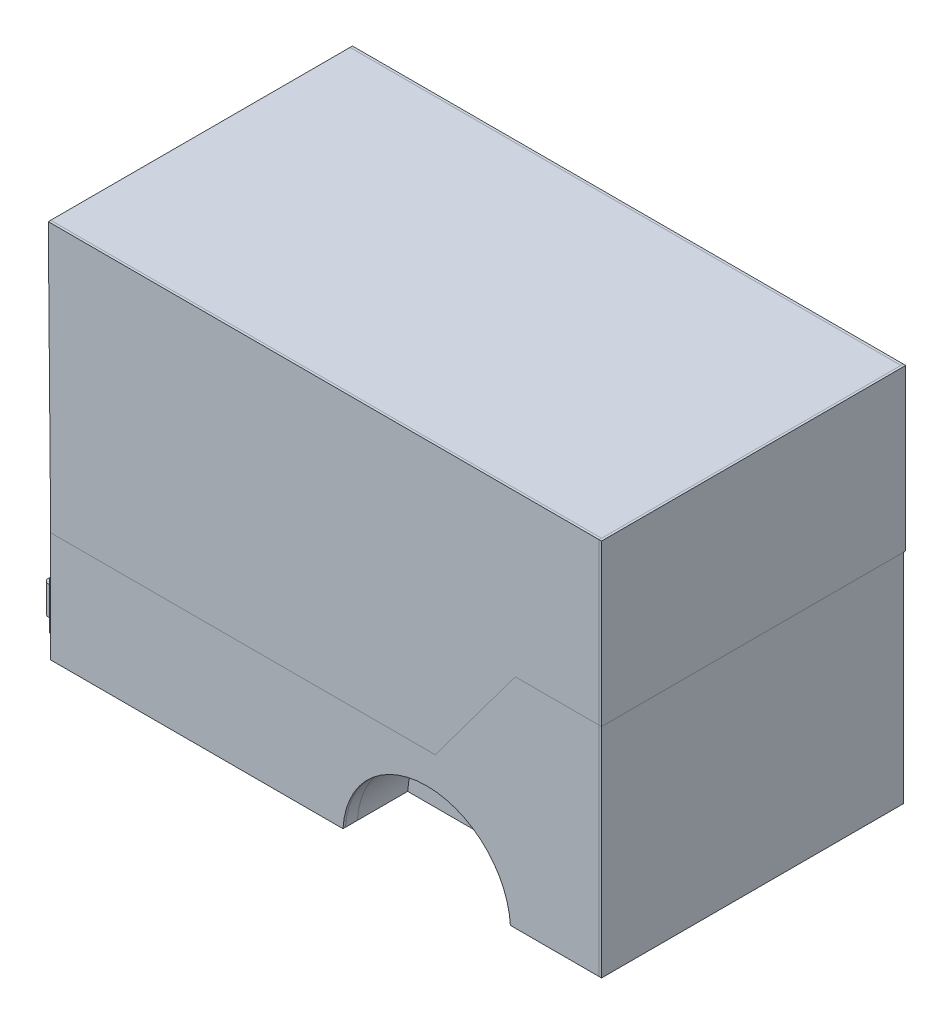
from build123d import *

# Parameters (mm, degrees)
SKETCH_1_W                = 229
SKETCH_1_H                = 125
EXTRUDE_1_DEPTH           = 88
SKETCH_4_W                = 125
SKETCH_4_H                = 88
SKETCH_4_W_2              = 123
SKETCH_4_H_2              = 86
CUT_EXTRUDE_3_DEPTH       = 1
SKETCH_5_W                = 125
SKETCH_5_H                = 88
EXTRUDE_2_DEPTH           = 1
SKETCH_11_W               = 5
SKETCH_11_H               = 20
EXTRUDE_3_DEPTH           = 2
SKETCH_12_R               = 2
EXTRUDE_4_DEPTH           = 12
SKETCH_13_R               = 35
CUT_EXTRUDE_7_DEPTH       = 26
CUT_EXTRUDE_START         = -26
SKETCH_14_R               = 35
CUT_EXTRUDE_8_DEPTH       = 26
SKETCH_16_W               = 229
SKETCH_16_H               = 125
EXTRUDE_6_DEPTH           = 70
SHELL_START               = -980.231317195
SHELL_1_OUTLINE_W         = 148
SHELL_1_OUTLINE_H         = 115
SHELL_1_DEPTH             = 113.617262665
SHELL_START_2             = -787.84857986
SHELL_1_2_OUTLINE_W       = 148
SHELL_1_2_OUTLINE_H       = 115
SHELL_1_2_DEPTH           = 31.617262665
SHELL_1_3_OUTLINE_W       = 3
SHELL_1_3_OUTLINE_H       = 63
SHELL_1_3_DEPTH           = 224
SHELL_START_3             = -981.231317195
SHELL_1_4_DEPTH           = 1
SHELL_START_4             = 7.020467364
SHELL_1_5_DEPTH           = 115
SHELL_START_5             = 33.020467364
SHELL_1_6_DEPTH           = 63
CUT_EXTRUDE_START_2       = -70
CUT_EXTRUDE_9_DEPTH       = 70
SKETCH_20_W               = 125
SKETCH_20_H               = 158
SKETCH_20_W_2             = 115
SKETCH_20_H_2             = 148
EXTRUDE_7_DEPTH           = 1
CUT_EXTRUDE_START_3       = -5
CUT_EXTRUDE_14_DEPTH      = 5
EXTRUDE_8_DEPTH           = 5
SKETCH_26_W               = 230
SKETCH_26_H               = 125
CUT_EXTRUDE_15_DEPTH      = 5
SKETCH_27_W               = 230
SKETCH_27_H               = 125
EXTRUDE_9_DEPTH           = 5
SKETCH_28_W               = 5
SKETCH_28_H               = 115
EXTRUDE_10_DEPTH          = 148
EXTRUDE_11_DEPTH          = 1
EXTRUDE_12_DEPTH          = 1
SKETCH_32_W               = 127
SKETCH_32_H               = 67.090624259
EXTRUDE_13_DEPTH          = 1
SKETCH_33_W               = 126
SKETCH_33_H               = 90.909375741
EXTRUDE_14_DEPTH          = 1
CUT_EXTRUDE_16_DEPTH      = 40
CUT_EXTRUDE_16_DEPTH_BACK = 10
SKETCH_34_W               = 225
SKETCH_34_H               = 5
SKETCH_35_W               = 220
SKETCH_35_H               = 153
EXTRUDE_16_DEPTH          = 5
SKETCH_36_W               = 5
SKETCH_36_H               = 153
EXTRUDE_17_DEPTH          = 5
CUT_EXTRUDE_17_DEPTH      = 5
SKETCH_39_W               = 115
SKETCH_39_H               = 5
CUT_EXTRUDE_18_DEPTH      = 5
SKETCH_40_W               = 5
SKETCH_40_H               = 120
EXTRUDE_19_DEPTH          = 153
SKETCH_45_W               = 78.76547467
SKETCH_45_H               = 26
EXTRUDE_21_DEPTH          = 33
CUT_EXTRUDE_20_DEPTH      = 21
SKETCH_48_R               = 34.912032086
CUT_EXTRUDE_21_DEPTH      = 21
SKETCH_49_W               = 26.617262665
SKETCH_49_H               = 26
EXTRUDE_22_DEPTH          = 33
EXTRUDE_22_2_DEPTH        = 33
SKETCH_49_W_2             = 27.3125
EXTRUDE_22_3_DEPTH        = 33
EXTRUDE_22_4_DEPTH        = 33
EXTRUDE_22_5_DEPTH        = 33
EXTRUDE_22_6_DEPTH        = 33
EXTRUDE_22_7_DEPTH        = 33
EXTRUDE_22_8_DEPTH        = 33
EXTRUDE_22_9_DEPTH        = 33
EXTRUDE_22_10_DEPTH       = 33
EXTRUDE_22_11_DEPTH       = 33
EXTRUDE_22_12_DEPTH       = 33
SKETCH_49_W_3             = 23.446369054
EXTRUDE_22_13_DEPTH       = 33
SKETCH_49_W_4             = 23.446369055
EXTRUDE_22_14_DEPTH       = 33
EXTRUDE_22_15_DEPTH       = 33
EXTRUDE_22_16_DEPTH       = 33
EXTRUDE_22_17_DEPTH       = 33
EXTRUDE_22_18_DEPTH       = 33
EXTRUDE_22_19_DEPTH       = 33
EXTRUDE_22_20_DEPTH       = 33
EXTRUDE_22_21_DEPTH       = 33
EXTRUDE_22_22_DEPTH       = 33
EXTRUDE_22_23_DEPTH       = 33
EXTRUDE_22_24_DEPTH       = 33
EXTRUDE_22_25_DEPTH       = 33
EXTRUDE_22_26_DEPTH       = 33
PATTERN_LINEAR_1_COUNT    = 4
PATTERN_LINEAR_1_PITCH    = 35
PATTERN_LINEAR_1_2_COUNT  = 4
PATTERN_LINEAR_1_2_PITCH  = 35
PATTERN_LINEAR_1_3_COUNT  = 4
PATTERN_LINEAR_1_3_PITCH  = 35
PATTERN_LINEAR_1_4_COUNT  = 4
PATTERN_LINEAR_1_4_PITCH  = 35
PATTERN_LINEAR_1_5_COUNT  = 4
PATTERN_LINEAR_1_5_PITCH  = 35
PATTERN_LINEAR_1_6_COUNT  = 4
PATTERN_LINEAR_1_6_PITCH  = 35
PATTERN_LINEAR_1_7_COUNT  = 4
PATTERN_LINEAR_1_7_PITCH  = 35
PATTERN_LINEAR_1_8_COUNT  = 4
PATTERN_LINEAR_1_8_PITCH  = 35
PATTERN_LINEAR_1_9_COUNT  = 4
PATTERN_LINEAR_1_9_PITCH  = 35
PATTERN_LINEAR_1_10_COUNT = 4
PATTERN_LINEAR_1_10_PITCH = 35
PATTERN_LINEAR_1_11_COUNT = 4
PATTERN_LINEAR_1_11_PITCH = 35
PATTERN_LINEAR_1_12_COUNT = 4
PATTERN_LINEAR_1_12_PITCH = 35
PATTERN_LINEAR_1_13_COUNT = 4
PATTERN_LINEAR_1_13_PITCH = 35
PATTERN_LINEAR_1_14_COUNT = 4
PATTERN_LINEAR_1_14_PITCH = 35
PATTERN_LINEAR_1_15_COUNT = 4
PATTERN_LINEAR_1_15_PITCH = 35
PATTERN_LINEAR_1_16_COUNT = 4
PATTERN_LINEAR_1_16_PITCH = 35
PATTERN_LINEAR_1_17_COUNT = 4
PATTERN_LINEAR_1_17_PITCH = 35
PATTERN_LINEAR_1_18_COUNT = 4
PATTERN_LINEAR_1_18_PITCH = 35
PATTERN_LINEAR_1_19_COUNT = 4
PATTERN_LINEAR_1_19_PITCH = 35
PATTERN_LINEAR_1_20_COUNT = 4
PATTERN_LINEAR_1_20_PITCH = 35
PATTERN_LINEAR_1_21_COUNT = 4
PATTERN_LINEAR_1_21_PITCH = 35
PATTERN_LINEAR_1_22_COUNT = 4
PATTERN_LINEAR_1_22_PITCH = 35
PATTERN_LINEAR_1_23_COUNT = 4
PATTERN_LINEAR_1_23_PITCH = 35
PATTERN_LINEAR_1_24_COUNT = 4
PATTERN_LINEAR_1_24_PITCH = 35
PATTERN_LINEAR_1_25_COUNT = 4
PATTERN_LINEAR_1_25_PITCH = 35
PATTERN_LINEAR_1_26_COUNT = 4
PATTERN_LINEAR_1_26_PITCH = 35
SKETCH_54_W               = 38.882737335
SKETCH_54_H               = 25
EXTRUDE_23_DEPTH          = 34
EXTRUDE_23_2_DEPTH        = 34
PATTERN_LINEAR_2_COUNT    = 3
PATTERN_LINEAR_2_PITCH    = 35
DELETE_START              = 110
DELETE_BODY_6_OUTLINE_W   = 23.446369054
DELETE_BODY_6_OUTLINE_H   = 26
DELETE_BODY_6_DEPTH       = 33
DELETE_BODY_7_OUTLINE_W   = 23.446369055
DELETE_BODY_7_OUTLINE_H   = 26
DELETE_BODY_7_DEPTH       = 33
DELETE_START_2            = 96.020467364
DELETE_BODY_8_OUTLINE_W   = 26.617262665
DELETE_BODY_8_OUTLINE_H   = 33
DELETE_BODY_8_DEPTH       = 26
DELETE_BODY_9_OUTLINE_W   = 26.617262665
DELETE_BODY_9_OUTLINE_H   = 33
DELETE_BODY_9_DEPTH       = 26
DELETE_BODY_10_OUTLINE_W  = 23.446369054
DELETE_BODY_10_OUTLINE_H  = 26
DELETE_BODY_10_DEPTH      = 33
DELETE_START_3            = 75
DELETE_BODY_11_OUTLINE_W  = 23.446369054
DELETE_BODY_11_OUTLINE_H  = 26
DELETE_BODY_11_DEPTH      = 33
DELETE_BODY_12_OUTLINE_W  = 23.446369055
DELETE_BODY_12_OUTLINE_H  = 26
DELETE_BODY_12_DEPTH      = 33


with BuildPart() as part:
    # 스케치1 → 보스-돌출1 (new body)
    with BuildSketch(Plane(origin=(0, 0, 0), x_dir=(1, 0, 0), z_dir=(0, 1, 0))):
        with Locations((-871.731317195, -64.520467364)):
            Rectangle(SKETCH_1_W, SKETCH_1_H)
    extrude(amount=EXTRUDE_1_DEPTH)

    # 스케치4 → 컷-돌출3 (cut)
    # profile 1 of 2: a face of its own
    with BuildSketch(Plane.ZY.offset(986.231317195)):
        with Locations((64.520467364, 44)):
            Rectangle(SKETCH_4_W, SKETCH_4_H)
        with Locations((64.520467364, 44)):
            Rectangle(SKETCH_4_W_2, SKETCH_4_H_2, mode=Mode.SUBTRACT)
    # profile 2 of 2: a face of its own
    with BuildSketch(Plane.ZY.offset(986.231317195)):
        with BuildLine():
            Line((6.020467364, 84), (6.020467364, 67.306026885))
            ThreePointArc((6.020467364, 67.306026885), (6.552613646, 56.95178287), (8.143444971, 46.70664722))
            Line((8.143444971, 46.70664722), (8.939528918, 42.885444272))
            ThreePointArc((8.939528918, 42.885444272), (10.498858633, 32.843182595), (11.020467364, 22.693973115))
            Line((11.020467364, 22.693973115), (11.020467364, 2))
            Line((11.020467364, 2), (118.020467364, 2))
            Line((118.020467364, 2), (118.020467364, 22.693973115))
            ThreePointArc((118.020467364, 22.693973115), (118.542076095, 32.843182595), (120.10140581, 42.885444272))
            Line((120.10140581, 42.885444272), (120.897489758, 46.70664722))
            ThreePointArc((120.897489758, 46.70664722), (122.488321083, 56.95178287), (123.020467364, 67.306026885))
            Line((123.020467364, 67.306026885), (123.020467364, 84))
            Line((123.020467364, 84), (6.020467364, 84))
        make_face()
        with BuildLine():
            Line((12.020467364, 22.693973115), (12.020467364, 3))
            Line((12.020467364, 3), (117.020467364, 3))
            Line((117.020467364, 3), (117.020467364, 22.693973115))
            ThreePointArc((117.020467364, 22.693973115), (117.547344871, 32.945699863), (119.122425391, 43.089398526))
            Line((119.122425391, 43.089398526), (119.918509338, 46.910601474))
            ThreePointArc((119.918509338, 46.910601474), (121.493589858, 57.054300137), (122.020467364, 67.306026885))
            Line((122.020467364, 67.306026885), (122.020467364, 83))
            Line((122.020467364, 83), (7.020467364, 83))
            Line((7.020467364, 83), (7.020467364, 67.306026885))
            ThreePointArc((7.020467364, 67.306026885), (7.547344871, 57.054300137), (9.122425391, 46.910601474))
            Line((9.122425391, 46.910601474), (9.918509338, 43.089398526))
            ThreePointArc((9.918509338, 43.089398526), (11.493589858, 32.945699863), (12.020467364, 22.693973115))
        make_face(mode=Mode.SUBTRACT)
    extrude(amount=-CUT_EXTRUDE_3_DEPTH, mode=Mode.SUBTRACT)

    # 스케치5 → 보스-돌출2 (add)
    with BuildSketch(Plane(origin=(-757.231317195, 0, 0), x_dir=(0, 0, -1), z_dir=(1, 0, 0))):
        with Locations((-64.520467364, 44)):
            Rectangle(SKETCH_5_W, SKETCH_5_H)
    extrude(amount=EXTRUDE_2_DEPTH)

    # 스케치13 → 컷-돌출7 (cut)
    with BuildSketch(Plane.XY.offset(127.020467364)):
        with Locations((-827.231317195, -2)):
            Circle(SKETCH_13_R)
    extrude(amount=-CUT_EXTRUDE_7_DEPTH, mode=Mode.SUBTRACT)

    # 스케치14 → 컷-돌출8 (cut)
    with BuildSketch(Plane(origin=(0, 0, 2.020467364), x_dir=(-1, 0, 0), z_dir=(0, 0, -1)).offset(CUT_EXTRUDE_START)):
        with Locations((827.231317195, -2)):
            Circle(SKETCH_14_R)
    extrude(amount=CUT_EXTRUDE_8_DEPTH, mode=Mode.SUBTRACT)

    # 스케치16 → 보스-돌출6 (add)
    with BuildSketch(Plane(origin=(0, 88, 0), x_dir=(1, 0, 0), z_dir=(0, 1, 0))):
        with Locations((-870.731317195, -64.520467364)):
            Rectangle(SKETCH_16_W, SKETCH_16_H)
    extrude(amount=EXTRUDE_6_DEPTH)

    # 쉘1: read off the stored shape, not the designer's step
    # 쉘1 outline → 쉘1 (cut)
    with BuildSketch(Plane.YZ.offset(SHELL_START)):
        with Locations((79, 64.520467364)):
            Rectangle(SHELL_1_OUTLINE_W, SHELL_1_OUTLINE_H)
    extrude(amount=SHELL_1_DEPTH, mode=Mode.SUBTRACT)

    # Shell 1 2 outline → Shell 1 2 (cut)
    with BuildSketch(Plane.YZ.offset(SHELL_START_2)):
        with Locations((79, 64.520467364)):
            Rectangle(SHELL_1_2_OUTLINE_W, SHELL_1_2_OUTLINE_H)
    extrude(amount=SHELL_1_2_DEPTH, mode=Mode.SUBTRACT)

    # Shell 1 3 outline → Shell 1 3 (cut)
    with BuildSketch(Plane.YZ.offset(SHELL_START)):
        with Locations((6.5, 64.520467364)):
            Rectangle(SHELL_1_3_OUTLINE_W, SHELL_1_3_OUTLINE_H)
    extrude(amount=SHELL_1_3_DEPTH, mode=Mode.SUBTRACT)

    # Shell 1 4 outline → Shell 1 4 (cut)
    with BuildSketch(Plane.YZ.offset(SHELL_START_3)):
        with BuildLine():
            Line((8, 96.020467364), (8, 33.020467364))
            Line((8, 33.020467364), (8, 17.020467364))
            Line((8, 17.020467364), (22.693973115, 17.020467364))
            ThreePointArc((22.693973115, 17.020467364), (33.4582862, 16.467245983), (44.109169797, 14.813411437))
            Line((44.109169797, 14.813411437), (47.930372745, 14.017327489))
            ThreePointArc((47.930372745, 14.017327489), (57.566886475, 12.521000995), (67.306026885, 12.020467364))
            Line((67.306026885, 12.020467364), (78, 12.020467364))
            Line((78, 12.020467364), (78, 117.020467364))
            Line((78, 117.020467364), (67.306026885, 117.020467364))
            ThreePointArc((67.306026885, 117.020467364), (57.566886475, 116.519933734), (47.930372745, 115.023607239))
            Line((47.930372745, 115.023607239), (44.109169797, 114.227523292))
            ThreePointArc((44.109169797, 114.227523292), (33.4582862, 112.573688746), (22.693973115, 112.020467364))
            Line((22.693973115, 112.020467364), (8, 112.020467364))
            Line((8, 112.020467364), (8, 96.020467364))
        make_face()
    extrude(amount=SHELL_1_4_DEPTH, mode=Mode.SUBTRACT)

    # Shell 1 5 outline → Shell 1 5 (cut)
    with BuildSketch(Plane.XY.offset(SHELL_START_4)):
        with BuildLine():
            Line((-787.84857986, 5), (-787.84857986, 153))
            Line((-787.84857986, 153), (-866.61405453, 153))
            Line((-866.61405453, 153), (-866.61405453, 5))
            ThreePointArc((-866.61405453, 5), (-827.231317195, 38), (-787.84857986, 5))
        make_face()
    extrude(amount=SHELL_1_5_DEPTH, mode=Mode.SUBTRACT)

    # Shell 1 6 outline → Shell 1 6 (cut)
    with BuildSketch(Plane.XY.offset(SHELL_START_5)):
        with BuildLine():
            Line((-865.961150657, 8), (-788.501483733, 8))
            ThreePointArc((-788.501483733, 8), (-827.231317195, 38), (-865.961150657, 8))
        make_face()
    extrude(amount=SHELL_1_6_DEPTH, mode=Mode.SUBTRACT)

    # 스케치18 → 컷-돌출9 (cut)
    with BuildSketch(Plane(origin=(-981.231317195, 0, 0), x_dir=(0, 0, -1), z_dir=(1, 0, 0)).offset(CUT_EXTRUDE_START_2)):
        with BuildLine():
            Line((-17.020467364, 8), (-17.020467364, 22.693973115))
            ThreePointArc((-17.020467364, 22.693973115), (-16.467245983, 33.4582862), (-14.813411437, 44.109169797))
            Line((-14.813411437, 44.109169797), (-14.017327489, 47.930372745))
            ThreePointArc((-14.017327489, 47.930372745), (-12.521000995, 57.566886475), (-12.020467364, 67.306026885))
            Line((-12.020467364, 67.306026885), (-12.020467364, 78))
            Line((-12.020467364, 78), (-117.020467364, 78))
            Line((-117.020467364, 78), (-117.020467364, 67.306026885))
            ThreePointArc((-117.020467364, 67.306026885), (-116.519933734, 57.566886475), (-115.023607239, 47.930372745))
            Line((-115.023607239, 47.930372745), (-114.227523292, 44.109169797))
            ThreePointArc((-114.227523292, 44.109169797), (-112.573688746, 33.4582862), (-112.020467364, 22.693973115))
            Line((-112.020467364, 22.693973115), (-112.020467364, 8))
            Line((-112.020467364, 8), (-17.020467364, 8))
        make_face()
    extrude(amount=CUT_EXTRUDE_9_DEPTH, mode=Mode.SUBTRACT)

    # 스케치20 → 보스-돌출7 (add)
    with BuildSketch(Plane(origin=(-756.231317195, 0, 0), x_dir=(0, 0, -1), z_dir=(1, 0, 0))):
        with Locations((-64.520467364, 79)):
            Rectangle(SKETCH_20_W, SKETCH_20_H)
        with Locations((-64.520467364, 79)):
            Rectangle(SKETCH_20_W_2, SKETCH_20_H_2, mode=Mode.SUBTRACT)
    extrude(amount=EXTRUDE_7_DEPTH)

    # 스케치24 → 컷-돌출14 (cut)
    with BuildSketch(Plane.XY.offset(127.020467364).offset(CUT_EXTRUDE_START_3)):
        with BuildLine():
            Line((-755.231317195, 153), (-980.231317195, 153))
            Line((-980.231317195, 153), (-980.231317195, 5))
            Line((-980.231317195, 5), (-866.61405453, 5))
            ThreePointArc((-866.61405453, 5), (-827.231317195, 38), (-787.84857986, 5))
            Line((-787.84857986, 5), (-755.231317195, 5))
            Line((-755.231317195, 5), (-755.231317195, 153))
        make_face()
    extrude(amount=CUT_EXTRUDE_14_DEPTH, mode=Mode.SUBTRACT)

    # 스케치26 → 컷-돌출15 (cut)
    with BuildSketch(Plane(origin=(0, 158, 0), x_dir=(1, 0, 0), z_dir=(0, 1, 0))):
        with Locations((-870.231317195, -64.520467364)):
            Rectangle(SKETCH_26_W, SKETCH_26_H)
    extrude(amount=-CUT_EXTRUDE_15_DEPTH, mode=Mode.SUBTRACT)

    # 스케치34 → 컷-돌출16 (cut, two sides: drawn at the far end of the back side and taken through both)
    with BuildSketch(Plane(origin=(0, 5, 0), x_dir=(1, 0, 0), z_dir=(0, 1, 0)).offset(-CUT_EXTRUDE_16_DEPTH_BACK)):
        with Locations((-867.731317195, -124.520467364)):
            Rectangle(SKETCH_34_W, SKETCH_34_H)
    extrude(amount=CUT_EXTRUDE_16_DEPTH + CUT_EXTRUDE_16_DEPTH_BACK, mode=Mode.SUBTRACT)

    # 스케치39 → 컷-돌출18 (cut)
    with BuildSketch(Plane(origin=(-755.231317195, 0, 0), x_dir=(0, 0, -1), z_dir=(1, 0, 0))):
        with Locations((-64.520467364, 2.5)):
            Rectangle(SKETCH_39_W, SKETCH_39_H)
    extrude(amount=-CUT_EXTRUDE_18_DEPTH, mode=Mode.SUBTRACT)

    # 스케치45 → 보스-돌출21 (add)
    with BuildSketch(Plane(origin=(0, 5, 0), x_dir=(1, 0, 0), z_dir=(0, 1, 0))):
        with Locations((-827.231317195, -20.020467364)):
            Rectangle(SKETCH_45_W, SKETCH_45_H)
        with Locations((-827.231317195, -109.020467364)):
            Rectangle(SKETCH_45_W, SKETCH_45_H)
    extrude(amount=EXTRUDE_21_DEPTH)

    # 스케치47 → 컷-돌출20 (cut)
    with BuildSketch(Plane.XY.offset(122.020467364)):
        with BuildLine():
            Line((-862.174127614, 0), (-792.288506775, 0))
            ThreePointArc((-792.288506775, 0), (-827.231317195, 33), (-862.174127614, 0))
        make_face()
    extrude(amount=-CUT_EXTRUDE_20_DEPTH, mode=Mode.SUBTRACT)

    # 스케치48 → 컷-돌출21 (cut)
    with BuildSketch(Plane(origin=(0, 0, 7.020467364), x_dir=(-1, 0, 0), z_dir=(0, 0, -1))):
        with Locations((827.252311569, -1.914574066)):
            Circle(SKETCH_48_R)
    extrude(amount=-CUT_EXTRUDE_21_DEPTH, mode=Mode.SUBTRACT)


with BuildPart() as body_2:
    # 스케치11 → 보스-돌출3 (new body)
    with BuildSketch(Plane.ZY.offset(986.231317195)):
        with Locations((122.020467364, 16)):
            Rectangle(SKETCH_11_W, SKETCH_11_H)
    extrude(amount=EXTRUDE_3_DEPTH)

    # 스케치12 → 보스-돌출4 (add)
    with BuildSketch(Plane(origin=(0, 23, 0), x_dir=(1, 0, 0), z_dir=(0, 1, 0))):
        with Locations((-989.231317195, -122.020467364)):
            Circle(SKETCH_12_R)
    extrude(amount=-EXTRUDE_4_DEPTH)


with BuildPart() as body_3:
    # 대칭 복사1: mirrored copy
    add(body_2.part.mirror(Plane.XY.offset(64.520467364)))


with BuildPart() as body_4:
    # 스케치25 → 보스-돌출8 (new body)
    with BuildSketch(Plane.XY.offset(127.020467364)):
        with BuildLine():
            Line((-980.231317195, 153), (-755.231317195, 153))
            Line((-755.231317195, 153), (-755.231317195, 5))
            Line((-755.231317195, 5), (-787.616277727, 5))
            ThreePointArc((-787.616277727, 5), (-826.999015062, 38), (-866.381752397, 5))
            Line((-866.381752397, 5), (-980.231317195, 5))
            Line((-980.231317195, 5), (-980.231317195, 153))
        make_face()
    extrude(amount=-EXTRUDE_8_DEPTH)


with BuildPart() as body_5:
    # 스케치27 → 보스-돌출9 (new body)
    with BuildSketch(Plane(origin=(0, 153, 0), x_dir=(1, 0, 0), z_dir=(0, 1, 0))):
        with Locations((-870.231317195, -64.520467364)):
            Rectangle(SKETCH_27_W, SKETCH_27_H)
    extrude(amount=EXTRUDE_9_DEPTH)


with BuildPart() as body_6:
    # 스케치28 → 보스-돌출10 (new body)
    with BuildSketch(Plane(origin=(0, 5, 0), x_dir=(1, 0, 0), z_dir=(0, 1, 0))):
        with Locations((-757.731317195, -64.520467364)):
            Rectangle(SKETCH_28_W, SKETCH_28_H)
    extrude(amount=EXTRUDE_10_DEPTH)


with BuildPart() as body_7:
    # 스케치29 → 보스-돌출11 (new body)
    with BuildSketch(Plane(origin=(0, 0, 2.020467364), x_dir=(-1, 0, 0), z_dir=(0, 0, -1))):
        with BuildLine():
            Line((984.231317195, 0), (984.231317195, 46))
            Line((984.231317195, 46), (823.655113572, 46))
            Line((823.655113572, 46), (790.231317195, 90.909375741))
            Line((790.231317195, 90.909375741), (755.231317195, 90.909375741))
            Line((755.231317195, 90.909375741), (755.231317195, 0))
            Line((755.231317195, 0), (792.288506775, 0))
            ThreePointArc((792.288506775, 0), (827.231317195, 33), (862.174127614, 0))
            Line((862.174127614, 0), (984.231317195, 0))
        make_face()
    extrude(amount=EXTRUDE_11_DEPTH)


with BuildPart() as body_8:
    # 스케치30 → 보스-돌출12 (new body)
    with BuildSketch(Plane(origin=(0, 0, 2.020467364), x_dir=(-1, 0, 0), z_dir=(0, 0, -1))):
        Polygon((755.231317195, 90.909375741), (755.231317195, 158), (985.231317195, 158), (984.231317195, 46), (823.655113572, 46), (790.231317195, 90.909375741), align=None)
    extrude(amount=EXTRUDE_12_DEPTH)


with BuildPart() as body_8_2:
    # 대칭 복사3: mirrored copy
    add(body_8.part.mirror(Plane.XY.offset(64.520467364)))


with BuildPart() as body_9:
    # Mirror 3 2: mirrored copy
    add(body_7.part.mirror(Plane.XY.offset(64.520467364)))


with BuildPart() as body_10:
    # 스케치32 → 보스-돌출13 (new body)
    with BuildSketch(Plane(origin=(-755.231317195, 0, 0), x_dir=(0, 0, -1), z_dir=(1, 0, 0))):
        with Locations((-64.520467364, 124.454687871)):
            Rectangle(SKETCH_32_W, SKETCH_32_H)
    extrude(amount=EXTRUDE_13_DEPTH)


with BuildPart() as body_11:
    # 스케치33 → 보스-돌출14 (new body)
    with BuildSketch(Plane(origin=(-755.231317195, 0, 0), x_dir=(0, 0, -1), z_dir=(1, 0, 0))):
        with Locations((-65.020467364, 45.454687871)):
            Rectangle(SKETCH_33_W, SKETCH_33_H)
    extrude(amount=EXTRUDE_14_DEPTH)


with BuildPart() as body_12:
    # 대칭 복사4: mirrored copy
    add(body_2.part.mirror(Plane.XY.offset(64.520467364)))


with BuildPart() as body_12_2:
    # 스케치35 → 보스-돌출16 (new body)
    with BuildSketch(Plane.XY.offset(122.020467364)):
        with Locations((-870.231317195, 76.5)):
            Rectangle(SKETCH_35_W, SKETCH_35_H)
    extrude(amount=EXTRUDE_16_DEPTH)

    # 스케치36 → 보스-돌출17 (add)
    with BuildSketch(Plane(origin=(-760.231317195, 0, 0), x_dir=(0, 0, -1), z_dir=(1, 0, 0))):
        with Locations((-124.520467364, 76.5)):
            Rectangle(SKETCH_36_W, SKETCH_36_H)
    extrude(amount=EXTRUDE_17_DEPTH)

    # 스케치37 → 컷-돌출17 (cut)
    with BuildSketch(Plane.XY.offset(127.020467364)):
        with BuildLine():
            Line((-862.174127614, 0), (-792.288506775, 0))
            ThreePointArc((-792.288506775, 0), (-827.231317195, 33), (-862.174127614, 0))
        make_face()
    extrude(amount=-CUT_EXTRUDE_17_DEPTH, mode=Mode.SUBTRACT)


with BuildPart() as body_12_3:
    # 스케치40 → 보스-돌출19 (new body)
    with BuildSketch(Plane.XZ):
        with Locations((-757.731317195, 67.020467364)):
            Rectangle(SKETCH_40_W, SKETCH_40_H)
    extrude(amount=-EXTRUDE_19_DEPTH)


with BuildPart() as body_13:
    # 스케치49 → 보스-돌출22 (new body)
    with BuildSketch(Plane(origin=(0, 5, 0), x_dir=(1, 0, 0), z_dir=(0, 1, 0))):
        with Locations((-773.539948528, -20.020467364)):
            Rectangle(SKETCH_49_W, SKETCH_49_H)
    extrude(amount=EXTRUDE_22_DEPTH)

    # 선형 패턴1: body 13 ×4


with BuildPart() as body_14:
    # 스케치49 → Extrude 22 2 (new body)
    with BuildSketch(Plane(origin=(0, 5, 0), x_dir=(1, 0, 0), z_dir=(0, 1, 0))):
        with Locations((-773.539948528, -109.020467364)):
            Rectangle(SKETCH_49_W, SKETCH_49_H)
    extrude(amount=EXTRUDE_22_2_DEPTH)

    # Pattern Linear 1 2: body 14 ×4


with BuildPart() as body_15:
    # 스케치49 → Extrude 22 3 (new body)
    with BuildSketch(Plane(origin=(0, 5, 0), x_dir=(1, 0, 0), z_dir=(0, 1, 0))):
        with Locations((-938.265067195, -109.020467364)):
            Rectangle(SKETCH_49_W_2, SKETCH_49_H)
    extrude(amount=EXTRUDE_22_3_DEPTH)

    # Pattern Linear 1 19: body 15 ×4


with BuildPart() as body_16:
    # 스케치49 → Extrude 22 4 (new body)
    with BuildSketch(Plane(origin=(0, 5, 0), x_dir=(1, 0, 0), z_dir=(0, 1, 0))):
        with Locations((-966.575067195, -109.020467364)):
            Rectangle(SKETCH_49_W_2, SKETCH_49_H)
    extrude(amount=EXTRUDE_22_4_DEPTH)

    # Pattern Linear 1 23: body 16 ×4


with BuildPart() as body_17:
    # 스케치49 → Extrude 22 5 (new body)
    with BuildSketch(Plane(origin=(0, 5, 0), x_dir=(1, 0, 0), z_dir=(0, 1, 0))):
        with Locations((-909.955067195, -109.020467364)):
            Rectangle(SKETCH_49_W_2, SKETCH_49_H)
    extrude(amount=EXTRUDE_22_5_DEPTH)

    # Pattern Linear 1 18: body 17 ×4


with BuildPart() as body_18:
    # 스케치49 → Extrude 22 6 (new body)
    with BuildSketch(Plane(origin=(0, 5, 0), x_dir=(1, 0, 0), z_dir=(0, 1, 0))):
        with Locations((-881.645067195, -109.020467364)):
            Rectangle(SKETCH_49_W_2, SKETCH_49_H)
    extrude(amount=EXTRUDE_22_6_DEPTH)

    # Pattern Linear 1 11: body 18 ×4


with BuildPart() as body_19:
    # 스케치49 → Extrude 22 7 (new body)
    with BuildSketch(Plane(origin=(0, 5, 0), x_dir=(1, 0, 0), z_dir=(0, 1, 0))):
        with Locations((-938.265067195, -80.020467364)):
            Rectangle(SKETCH_49_W_2, SKETCH_49_H)
    extrude(amount=EXTRUDE_22_7_DEPTH)

    # Pattern Linear 1 20: body 19 ×4


with BuildPart() as body_20:
    # 스케치49 → Extrude 22 8 (new body)
    with BuildSketch(Plane(origin=(0, 5, 0), x_dir=(1, 0, 0), z_dir=(0, 1, 0))):
        with Locations((-909.955067195, -80.020467364)):
            Rectangle(SKETCH_49_W_2, SKETCH_49_H)
    extrude(amount=EXTRUDE_22_8_DEPTH)

    # Pattern Linear 1 17: body 20 ×4


with BuildPart() as body_21:
    # 스케치49 → Extrude 22 9 (new body)
    with BuildSketch(Plane(origin=(0, 5, 0), x_dir=(1, 0, 0), z_dir=(0, 1, 0))):
        with Locations((-881.645067195, -80.020467364)):
            Rectangle(SKETCH_49_W_2, SKETCH_49_H)
    extrude(amount=EXTRUDE_22_9_DEPTH)

    # Pattern Linear 1 12: body 21 ×4


with BuildPart() as body_22:
    # 스케치49 → Extrude 22 10 (new body)
    with BuildSketch(Plane(origin=(0, 5, 0), x_dir=(1, 0, 0), z_dir=(0, 1, 0))):
        with Locations((-966.575067195, -80.020467364)):
            Rectangle(SKETCH_49_W_2, SKETCH_49_H)
    extrude(amount=EXTRUDE_22_10_DEPTH)

    # Pattern Linear 1 24: body 22 ×4


with BuildPart() as body_23:
    # 스케치49 → Extrude 22 11 (new body)
    with BuildSketch(Plane(origin=(0, 5, 0), x_dir=(1, 0, 0), z_dir=(0, 1, 0))):
        with Locations((-853.335067195, -80.020467364)):
            Rectangle(SKETCH_49_W_2, SKETCH_49_H)
    extrude(amount=EXTRUDE_22_11_DEPTH)

    # Pattern Linear 1 10: body 23 ×4


with BuildPart() as body_24:
    # 스케치49 → Extrude 22 12 (new body)
    with BuildSketch(Plane(origin=(0, 5, 0), x_dir=(1, 0, 0), z_dir=(0, 1, 0))):
        with Locations((-825.025067195, -80.020467364)):
            Rectangle(SKETCH_49_W_2, SKETCH_49_H)
    extrude(amount=EXTRUDE_22_12_DEPTH)

    # Pattern Linear 1 7: body 24 ×4


with BuildPart() as body_25:
    # 스케치49 → Extrude 22 13 (new body)
    with BuildSketch(Plane(origin=(0, 5, 0), x_dir=(1, 0, 0), z_dir=(0, 1, 0))):
        with Locations((-771.954501722, -80.020467364)):
            Rectangle(SKETCH_49_W_3, SKETCH_49_H)
    extrude(amount=EXTRUDE_22_13_DEPTH)

    # Pattern Linear 1 3: body 25 ×4


with BuildPart() as body_26:
    # 스케치49 → Extrude 22 14 (new body)
    with BuildSketch(Plane(origin=(0, 5, 0), x_dir=(1, 0, 0), z_dir=(0, 1, 0))):
        with Locations((-796.400870777, -80.020467364)):
            Rectangle(SKETCH_49_W_4, SKETCH_49_H)
    extrude(amount=EXTRUDE_22_14_DEPTH)

    # Pattern Linear 1 6: body 26 ×4


with BuildPart() as body_27:
    # 스케치49 → Extrude 22 15 (new body)
    with BuildSketch(Plane(origin=(0, 5, 0), x_dir=(1, 0, 0), z_dir=(0, 1, 0))):
        with Locations((-771.954501722, -49.020467364)):
            Rectangle(SKETCH_49_W_3, SKETCH_49_H)
    extrude(amount=EXTRUDE_22_15_DEPTH)

    # Pattern Linear 1 4: body 27 ×4


with BuildPart() as body_28:
    # 스케치49 → Extrude 22 16 (new body)
    with BuildSketch(Plane(origin=(0, 5, 0), x_dir=(1, 0, 0), z_dir=(0, 1, 0))):
        with Locations((-796.400870777, -49.020467364)):
            Rectangle(SKETCH_49_W_4, SKETCH_49_H)
    extrude(amount=EXTRUDE_22_16_DEPTH)

    # Pattern Linear 1 5: body 28 ×4


with BuildPart() as body_29:
    # 스케치49 → Extrude 22 17 (new body)
    with BuildSketch(Plane(origin=(0, 5, 0), x_dir=(1, 0, 0), z_dir=(0, 1, 0))):
        with Locations((-825.025067195, -49.020467364)):
            Rectangle(SKETCH_49_W_2, SKETCH_49_H)
    extrude(amount=EXTRUDE_22_17_DEPTH)

    # Pattern Linear 1 8: body 29 ×4


with BuildPart() as body_30:
    # 스케치49 → Extrude 22 18 (new body)
    with BuildSketch(Plane(origin=(0, 5, 0), x_dir=(1, 0, 0), z_dir=(0, 1, 0))):
        with Locations((-853.335067195, -49.020467364)):
            Rectangle(SKETCH_49_W_2, SKETCH_49_H)
    extrude(amount=EXTRUDE_22_18_DEPTH)

    # Pattern Linear 1 9: body 30 ×4


with BuildPart() as body_31:
    # 스케치49 → Extrude 22 19 (new body)
    with BuildSketch(Plane(origin=(0, 5, 0), x_dir=(1, 0, 0), z_dir=(0, 1, 0))):
        with Locations((-966.575067195, -49.020467364)):
            Rectangle(SKETCH_49_W_2, SKETCH_49_H)
    extrude(amount=EXTRUDE_22_19_DEPTH)

    # Pattern Linear 1 25: body 31 ×4


with BuildPart() as body_32:
    # 스케치49 → Extrude 22 20 (new body)
    with BuildSketch(Plane(origin=(0, 5, 0), x_dir=(1, 0, 0), z_dir=(0, 1, 0))):
        with Locations((-881.645067195, -49.020467364)):
            Rectangle(SKETCH_49_W_2, SKETCH_49_H)
    extrude(amount=EXTRUDE_22_20_DEPTH)

    # Pattern Linear 1 13: body 32 ×4


with BuildPart() as body_33:
    # 스케치49 → Extrude 22 21 (new body)
    with BuildSketch(Plane(origin=(0, 5, 0), x_dir=(1, 0, 0), z_dir=(0, 1, 0))):
        with Locations((-909.955067195, -49.020467364)):
            Rectangle(SKETCH_49_W_2, SKETCH_49_H)
    extrude(amount=EXTRUDE_22_21_DEPTH)

    # Pattern Linear 1 16: body 33 ×4


with BuildPart() as body_34:
    # 스케치49 → Extrude 22 22 (new body)
    with BuildSketch(Plane(origin=(0, 5, 0), x_dir=(1, 0, 0), z_dir=(0, 1, 0))):
        with Locations((-938.265067195, -49.020467364)):
            Rectangle(SKETCH_49_W_2, SKETCH_49_H)
    extrude(amount=EXTRUDE_22_22_DEPTH)

    # Pattern Linear 1 21: body 34 ×4


with BuildPart() as body_35:
    # 스케치49 → Extrude 22 23 (new body)
    with BuildSketch(Plane(origin=(0, 5, 0), x_dir=(1, 0, 0), z_dir=(0, 1, 0))):
        with Locations((-881.645067195, -20.020467364)):
            Rectangle(SKETCH_49_W_2, SKETCH_49_H)
    extrude(amount=EXTRUDE_22_23_DEPTH)

    # Pattern Linear 1 14: body 35 ×4


with BuildPart() as body_36:
    # 스케치49 → Extrude 22 24 (new body)
    with BuildSketch(Plane(origin=(0, 5, 0), x_dir=(1, 0, 0), z_dir=(0, 1, 0))):
        with Locations((-909.955067195, -20.020467364)):
            Rectangle(SKETCH_49_W_2, SKETCH_49_H)
    extrude(amount=EXTRUDE_22_24_DEPTH)

    # Pattern Linear 1 15: body 36 ×4


with BuildPart() as body_37:
    # 스케치49 → Extrude 22 25 (new body)
    with BuildSketch(Plane(origin=(0, 5, 0), x_dir=(1, 0, 0), z_dir=(0, 1, 0))):
        with Locations((-938.265067195, -20.020467364)):
            Rectangle(SKETCH_49_W_2, SKETCH_49_H)
    extrude(amount=EXTRUDE_22_25_DEPTH)

    # Pattern Linear 1 22: body 37 ×4


with BuildPart() as body_38:
    # 스케치49 → Extrude 22 26 (new body)
    with BuildSketch(Plane(origin=(0, 5, 0), x_dir=(1, 0, 0), z_dir=(0, 1, 0))):
        with Locations((-966.575067195, -20.020467364)):
            Rectangle(SKETCH_49_W_2, SKETCH_49_H)
    extrude(amount=EXTRUDE_22_26_DEPTH)

    # Pattern Linear 1 26: body 38 ×4


with BuildPart() as body_13_1:
    add(body_13.part)
    with Locations(*[(0, i * PATTERN_LINEAR_1_PITCH, 0) for i in range(1, PATTERN_LINEAR_1_COUNT)]):
        add(body_13.part)


with BuildPart() as body_14_1:
    add(body_14.part)
    with Locations(*[(0, i * PATTERN_LINEAR_1_2_PITCH, 0) for i in range(1, PATTERN_LINEAR_1_2_COUNT)]):
        add(body_14.part)

    # Delete Body 8: read off the stored shape, not the designer's step
    # Delete Body 8 outline → Delete Body 8 (cut)
    with BuildSketch(Plane.XY.offset(DELETE_START_2)):
        with Locations((-773.539948528, 126.5)):
            Rectangle(DELETE_BODY_8_OUTLINE_W, DELETE_BODY_8_OUTLINE_H)
    extrude(amount=DELETE_BODY_8_DEPTH, mode=Mode.SUBTRACT)

    # Delete Body 9: read off the stored shape, not the designer's step
    # Delete Body 9 outline → Delete Body 9 (cut)
    with BuildSketch(Plane.XY.offset(DELETE_START_2)):
        with Locations((-773.539948528, 91.5)):
            Rectangle(DELETE_BODY_9_OUTLINE_W, DELETE_BODY_9_OUTLINE_H)
    extrude(amount=DELETE_BODY_9_DEPTH, mode=Mode.SUBTRACT)


with BuildPart() as body_25_1:
    add(body_25.part)
    with Locations(*[(0, i * PATTERN_LINEAR_1_3_PITCH, 0) for i in range(1, PATTERN_LINEAR_1_3_COUNT)]):
        add(body_25.part)

    # Delete Body 10: read off the stored shape, not the designer's step
    # Delete Body 10 outline → Delete Body 10 (cut)
    with BuildSketch(Plane(origin=(0, 0, 0), x_dir=(1, 0, 0), z_dir=(0, 1, 0)).offset(DELETE_START)):
        with Locations((-771.954501722, -80.020467364)):
            Rectangle(DELETE_BODY_10_OUTLINE_W, DELETE_BODY_10_OUTLINE_H)
    extrude(amount=DELETE_BODY_10_DEPTH, mode=Mode.SUBTRACT)

    # Delete Body 11: read off the stored shape, not the designer's step
    # Delete Body 11 outline → Delete Body 11 (cut)
    with BuildSketch(Plane(origin=(0, 0, 0), x_dir=(1, 0, 0), z_dir=(0, 1, 0)).offset(DELETE_START_3)):
        with Locations((-771.954501722, -80.020467364)):
            Rectangle(DELETE_BODY_11_OUTLINE_W, DELETE_BODY_11_OUTLINE_H)
    extrude(amount=DELETE_BODY_11_DEPTH, mode=Mode.SUBTRACT)


with BuildPart() as body_27_1:
    add(body_27.part)
    with Locations(*[(0, i * PATTERN_LINEAR_1_4_PITCH, 0) for i in range(1, PATTERN_LINEAR_1_4_COUNT)]):
        add(body_27.part)

    # Delete Body 6: read off the stored shape, not the designer's step
    # Delete Body 6 outline → Delete Body 6 (cut)
    with BuildSketch(Plane(origin=(0, 0, 0), x_dir=(1, 0, 0), z_dir=(0, 1, 0)).offset(DELETE_START)):
        with Locations((-771.954501722, -49.020467364)):
            Rectangle(DELETE_BODY_6_OUTLINE_W, DELETE_BODY_6_OUTLINE_H)
    extrude(amount=DELETE_BODY_6_DEPTH, mode=Mode.SUBTRACT)


with BuildPart() as body_28_1:
    add(body_28.part)
    with Locations(*[(0, i * PATTERN_LINEAR_1_5_PITCH, 0) for i in range(1, PATTERN_LINEAR_1_5_COUNT)]):
        add(body_28.part)

    # Delete Body 7: read off the stored shape, not the designer's step
    # Delete Body 7 outline → Delete Body 7 (cut)
    with BuildSketch(Plane(origin=(0, 0, 0), x_dir=(1, 0, 0), z_dir=(0, 1, 0)).offset(DELETE_START)):
        with Locations((-796.400870777, -49.020467364)):
            Rectangle(DELETE_BODY_7_OUTLINE_W, DELETE_BODY_7_OUTLINE_H)
    extrude(amount=DELETE_BODY_7_DEPTH, mode=Mode.SUBTRACT)


with BuildPart() as body_26_1:
    add(body_26.part)
    with Locations(*[(0, i * PATTERN_LINEAR_1_6_PITCH, 0) for i in range(1, PATTERN_LINEAR_1_6_COUNT)]):
        add(body_26.part)

    # Delete Body 12: read off the stored shape, not the designer's step
    # Delete Body 12 outline → Delete Body 12 (cut)
    with BuildSketch(Plane(origin=(0, 0, 0), x_dir=(1, 0, 0), z_dir=(0, 1, 0)).offset(DELETE_START)):
        with Locations((-796.400870777, -80.020467364)):
            Rectangle(DELETE_BODY_12_OUTLINE_W, DELETE_BODY_12_OUTLINE_H)
    extrude(amount=DELETE_BODY_12_DEPTH, mode=Mode.SUBTRACT)


with BuildPart() as body_24_1:
    add(body_24.part)
    with Locations(*[(0, i * PATTERN_LINEAR_1_7_PITCH, 0) for i in range(1, PATTERN_LINEAR_1_7_COUNT)]):
        add(body_24.part)


with BuildPart() as body_29_1:
    add(body_29.part)
    with Locations(*[(0, i * PATTERN_LINEAR_1_8_PITCH, 0) for i in range(1, PATTERN_LINEAR_1_8_COUNT)]):
        add(body_29.part)


with BuildPart() as body_30_1:
    add(body_30.part)
    with Locations(*[(0, i * PATTERN_LINEAR_1_9_PITCH, 0) for i in range(1, PATTERN_LINEAR_1_9_COUNT)]):
        add(body_30.part)


with BuildPart() as body_23_1:
    add(body_23.part)
    with Locations(*[(0, i * PATTERN_LINEAR_1_10_PITCH, 0) for i in range(1, PATTERN_LINEAR_1_10_COUNT)]):
        add(body_23.part)


with BuildPart() as body_18_1:
    add(body_18.part)
    with Locations(*[(0, i * PATTERN_LINEAR_1_11_PITCH, 0) for i in range(1, PATTERN_LINEAR_1_11_COUNT)]):
        add(body_18.part)


with BuildPart() as body_21_1:
    add(body_21.part)
    with Locations(*[(0, i * PATTERN_LINEAR_1_12_PITCH, 0) for i in range(1, PATTERN_LINEAR_1_12_COUNT)]):
        add(body_21.part)


with BuildPart() as body_32_1:
    add(body_32.part)
    with Locations(*[(0, i * PATTERN_LINEAR_1_13_PITCH, 0) for i in range(1, PATTERN_LINEAR_1_13_COUNT)]):
        add(body_32.part)


with BuildPart() as body_35_1:
    add(body_35.part)
    with Locations(*[(0, i * PATTERN_LINEAR_1_14_PITCH, 0) for i in range(1, PATTERN_LINEAR_1_14_COUNT)]):
        add(body_35.part)


with BuildPart() as body_36_1:
    add(body_36.part)
    with Locations(*[(0, i * PATTERN_LINEAR_1_15_PITCH, 0) for i in range(1, PATTERN_LINEAR_1_15_COUNT)]):
        add(body_36.part)


with BuildPart() as body_33_1:
    add(body_33.part)
    with Locations(*[(0, i * PATTERN_LINEAR_1_16_PITCH, 0) for i in range(1, PATTERN_LINEAR_1_16_COUNT)]):
        add(body_33.part)


with BuildPart() as body_20_1:
    add(body_20.part)
    with Locations(*[(0, i * PATTERN_LINEAR_1_17_PITCH, 0) for i in range(1, PATTERN_LINEAR_1_17_COUNT)]):
        add(body_20.part)


with BuildPart() as body_17_1:
    add(body_17.part)
    with Locations(*[(0, i * PATTERN_LINEAR_1_18_PITCH, 0) for i in range(1, PATTERN_LINEAR_1_18_COUNT)]):
        add(body_17.part)


with BuildPart() as body_15_1:
    add(body_15.part)
    with Locations(*[(0, i * PATTERN_LINEAR_1_19_PITCH, 0) for i in range(1, PATTERN_LINEAR_1_19_COUNT)]):
        add(body_15.part)


with BuildPart() as body_19_1:
    add(body_19.part)
    with Locations(*[(0, i * PATTERN_LINEAR_1_20_PITCH, 0) for i in range(1, PATTERN_LINEAR_1_20_COUNT)]):
        add(body_19.part)


with BuildPart() as body_34_1:
    add(body_34.part)
    with Locations(*[(0, i * PATTERN_LINEAR_1_21_PITCH, 0) for i in range(1, PATTERN_LINEAR_1_21_COUNT)]):
        add(body_34.part)


with BuildPart() as body_37_1:
    add(body_37.part)
    with Locations(*[(0, i * PATTERN_LINEAR_1_22_PITCH, 0) for i in range(1, PATTERN_LINEAR_1_22_COUNT)]):
        add(body_37.part)


with BuildPart() as body_16_1:
    add(body_16.part)
    with Locations(*[(0, i * PATTERN_LINEAR_1_23_PITCH, 0) for i in range(1, PATTERN_LINEAR_1_23_COUNT)]):
        add(body_16.part)


with BuildPart() as body_22_1:
    add(body_22.part)
    with Locations(*[(0, i * PATTERN_LINEAR_1_24_PITCH, 0) for i in range(1, PATTERN_LINEAR_1_24_COUNT)]):
        add(body_22.part)


with BuildPart() as body_31_1:
    add(body_31.part)
    with Locations(*[(0, i * PATTERN_LINEAR_1_25_PITCH, 0) for i in range(1, PATTERN_LINEAR_1_25_COUNT)]):
        add(body_31.part)


with BuildPart() as body_38_1:
    add(body_38.part)
    with Locations(*[(0, i * PATTERN_LINEAR_1_26_PITCH, 0) for i in range(1, PATTERN_LINEAR_1_26_COUNT)]):
        add(body_38.part)


with BuildPart() as body_39:
    # 스케치54 → 보스-돌출23 (new body)
    with BuildSketch(Plane(origin=(0, 39, 0), x_dir=(1, 0, 0), z_dir=(0, 1, 0))):
        with Locations((-847.172685863, -109.520467364)):
            Rectangle(SKETCH_54_W, SKETCH_54_H)
    extrude(amount=EXTRUDE_23_DEPTH)


with BuildPart() as body_40:
    # 스케치54 → Extrude 23 2 (new body)
    with BuildSketch(Plane(origin=(0, 39, 0), x_dir=(1, 0, 0), z_dir=(0, 1, 0))):
        with Locations((-807.289948528, -109.520467364)):
            Rectangle(SKETCH_54_W, SKETCH_54_H)
    extrude(amount=EXTRUDE_23_2_DEPTH)


with BuildPart() as body_41:
    # 대칭 복사5: mirrored copy
    add(body_39.part.mirror(Plane.XY.offset(64.520467364)))


with BuildPart() as body_42:
    # Mirror 5 2: mirrored copy
    add(body_40.part.mirror(Plane.XY.offset(64.520467364)))


with BuildPart() as pattern_linear_2_1:
    # 선형 패턴2: pattern copy
    add(body_42.part.moved(Location(Vector(0, 1, 0) * (1 * PATTERN_LINEAR_2_PITCH))))


with BuildPart() as pattern_linear_2_2:
    # 선형 패턴2: pattern copy
    add(body_42.part.moved(Location(Vector(0, 1, 0) * (2 * PATTERN_LINEAR_2_PITCH))))


with BuildPart() as pattern_linear_2_3:
    # 선형 패턴2: pattern copy
    add(body_41.part.moved(Location(Vector(0, 1, 0) * (1 * PATTERN_LINEAR_2_PITCH))))


with BuildPart() as pattern_linear_2_4:
    # 선형 패턴2: pattern copy
    add(body_41.part.moved(Location(Vector(0, 1, 0) * (2 * PATTERN_LINEAR_2_PITCH))))


with BuildPart() as pattern_linear_2_5:
    # 선형 패턴2: pattern copy
    add(body_40.part.moved(Location(Vector(0, 1, 0) * (1 * PATTERN_LINEAR_2_PITCH))))


with BuildPart() as pattern_linear_2_6:
    # 선형 패턴2: pattern copy
    add(body_40.part.moved(Location(Vector(0, 1, 0) * (2 * PATTERN_LINEAR_2_PITCH))))


with BuildPart() as pattern_linear_2_7:
    # 선형 패턴2: pattern copy
    add(body_39.part.moved(Location(Vector(0, 1, 0) * (1 * PATTERN_LINEAR_2_PITCH))))


with BuildPart() as pattern_linear_2_8:
    # 선형 패턴2: pattern copy
    add(body_39.part.moved(Location(Vector(0, 1, 0) * (2 * PATTERN_LINEAR_2_PITCH))))


solid = Compound([part.part, body_2.part, body_5.part, body_7.part, body_8.part, body_8_2.part, body_9.part, body_10.part, body_11.part, body_12.part, body_12_2.part, body_12_3.part, body_13_1.part, body_14_1.part, body_25_1.part, body_27_1.part, body_28_1.part, body_26_1.part, body_24_1.part, body_29_1.part, body_30_1.part, body_23_1.part, body_18_1.part, body_21_1.part, body_32_1.part, body_35_1.part, body_36_1.part, body_33_1.part, body_20_1.part, body_17_1.part, body_15_1.part, body_19_1.part, body_34_1.part, body_37_1.part, body_16_1.part, body_22_1.part, body_31_1.part, body_38_1.part, body_39.part, body_40.part, body_41.part, body_42.part, pattern_linear_2_1.part, pattern_linear_2_2.part, pattern_linear_2_3.part, pattern_linear_2_4.part, pattern_linear_2_5.part, pattern_linear_2_7.part, pattern_linear_2_8.part])
